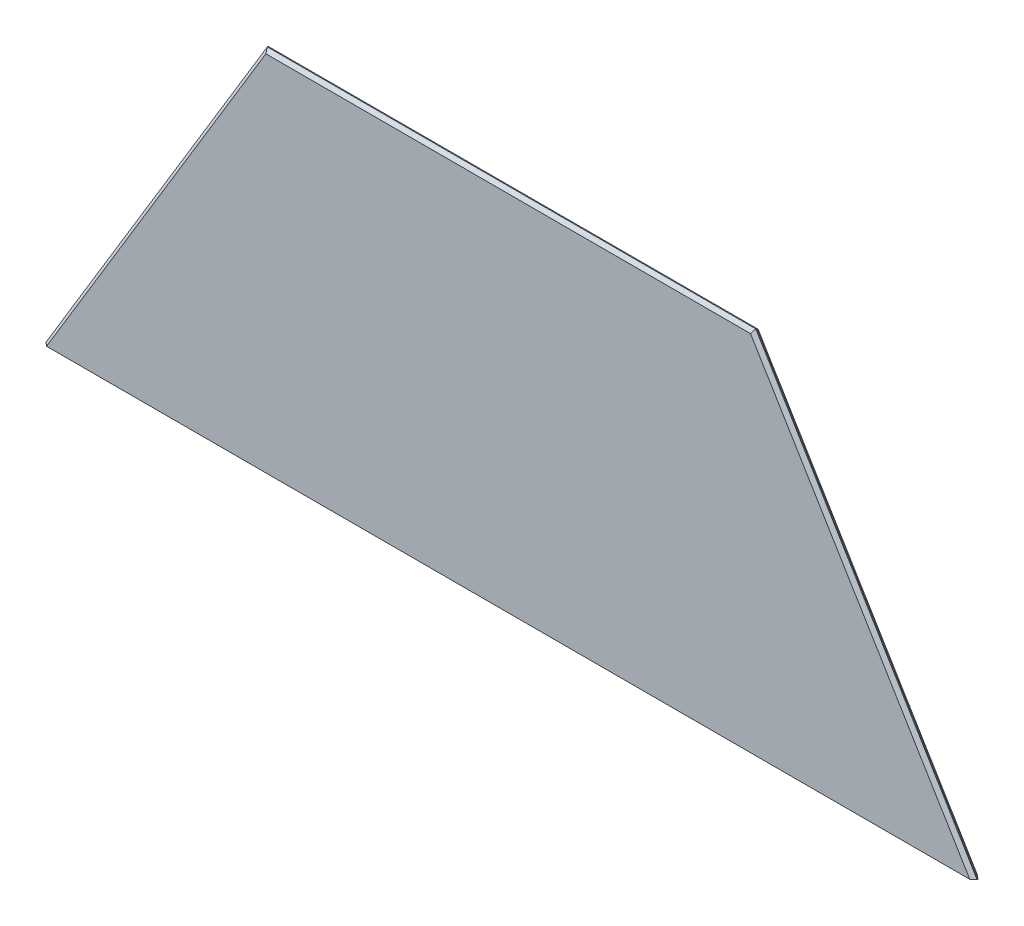
from build123d import *

# Parameters (mm, degrees)
EXTRUDE1_DEPTH = 1.5875
CHAMFER1_SIZE  = 1.397


with BuildPart() as part:
    # Sketch1 → Extrude1 (new, symmetric)
    with BuildSketch(Plane.XY):
        Polygon((0, 0), (193.675, 0), (101.6, 152.4), (0, 152.4), (-101.6, 152.4), (-193.675, 0), align=None)
    extrude(amount=EXTRUDE1_DEPTH, both=True)

    # Chamfer1
    chamfer1_edges = [part.edges().sort_by_distance(p)[0] for p in [
        (147.6375, 76.2, -1.5875),
        (0, 152.4, -1.5875),
        (-147.6375, 76.2, -1.5875),
        (147.6375, 76.2, 1.5875),
        (0, 152.4, 1.5875),
        (-147.6375, 76.2, 1.5875),
    ]]
    chamfer(chamfer1_edges, length=CHAMFER1_SIZE)


solid = part.part
